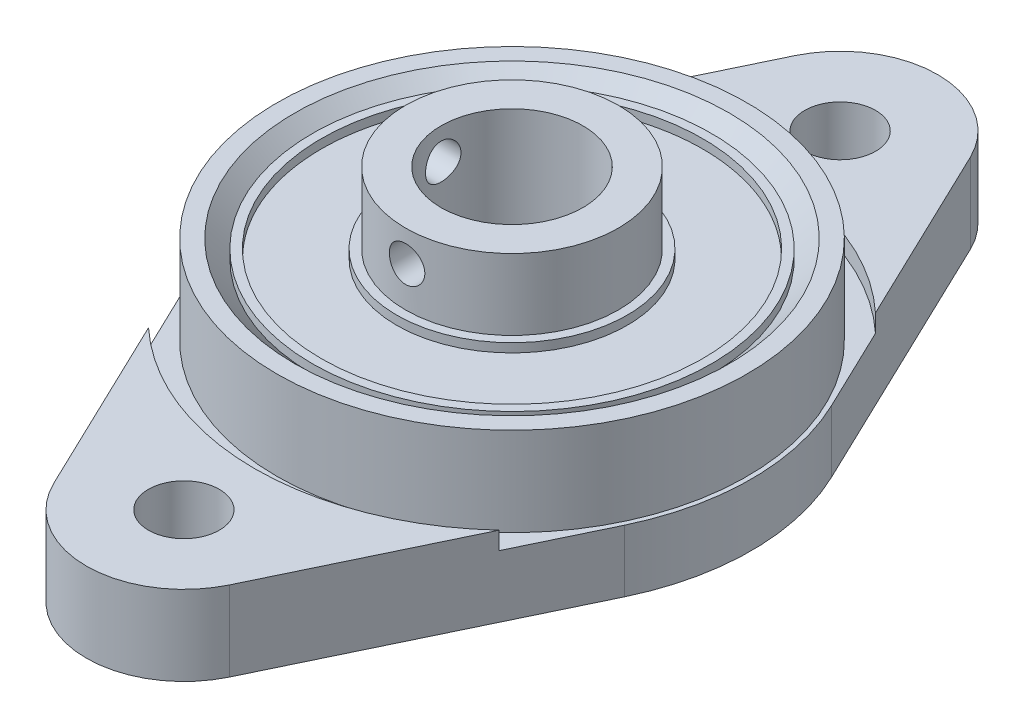
from build123d import *

# Parameters (mm, degrees)
SKETCH1_R             = 2
BOSS_EXTRUDE1_DEPTH   = 4.5
BOSS_EXTRUDE1_2_DEPTH = 4.5
SKETCH1_3_R           = 13.5
SKETCH1_3_R_2         = 13.25
BOSS_EXTRUDE2_DEPTH   = 3.5
SKETCH1_5_R           = 13.25
SKETCH1_5_R_2         = 12.25
BOSS_EXTRUDE3_DEPTH   = 8.5
SKETCH1_6_R           = 6
SKETCH1_6_R_2         = 4
BOSS_EXTRUDE4_DEPTH   = 12
SKETCH1_7_R           = 12.25
SKETCH1_7_R_2         = 11.25
BOSS_EXTRUDE5_DEPTH   = 8.5
CHAMFER1_SIZE         = 1
SKETCH2_R             = 11.25
SKETCH2_R_2           = 10.75
SKETCH2_R_3           = 6.5
SKETCH2_R_4           = 6
BOSS_EXTRUDE6_DEPTH   = 3.75
SKETCH2_3_R           = 10.75
SKETCH2_3_R_2         = 6.5
BOSS_EXTRUDE7_DEPTH   = 3.25
SKETCH3_R             = 1
CUT_EXTRUDE2_DEPTH    = 7.5
CIRPATTERN1_COUNT     = 2
CIRPATTERN1_ANGLE     = 90


with BuildPart() as part:
    # Sketch1 → Boss-Extrude1 (new body)
    with BuildSketch(Plane(origin=(0, 0, 0), x_dir=(1, 0, 0), z_dir=(0, 1, 0))):
        with BuildLine():
            Line((4.959164878, -20.878378378), (9.88427826, -10.609007648))
            ThreePointArc((9.88427826, -10.609007648), (0, -14.5), (-9.88427826, -10.609007648))
            Line((-9.88427826, -10.609007648), (-4.959164878, -20.878378378))
            ThreePointArc((-4.959164878, -20.878378378), (0, -24), (4.959164878, -20.878378378))
        make_face()
        with Locations(Location((0, -18.5, 0), (0, 0, 270))):
            Circle(SKETCH1_R, mode=Mode.SUBTRACT)
    extrude(amount=BOSS_EXTRUDE1_DEPTH)



with BuildPart() as body_2:
    # Sketch1 → Boss-Extrude1 2 (new body)
    with BuildSketch(Plane(origin=(0, 0, 0), x_dir=(1, 0, 0), z_dir=(0, 1, 0))):
        with BuildLine():
            ThreePointArc((-9.88427826, 10.609007648), (0, 14.5), (9.88427826, 10.609007648))
            Line((9.88427826, 10.609007648), (4.959164878, 20.878378378))
            ThreePointArc((4.959164878, 20.878378378), (0, 24), (-4.959164878, 20.878378378))
            Line((-4.959164878, 20.878378378), (-9.88427826, 10.609007648))
        make_face()
        with Locations(Location((0, 18.5, 0), (0, 0, 270))):
            Circle(SKETCH1_R, mode=Mode.SUBTRACT)
    extrude(amount=BOSS_EXTRUDE1_2_DEPTH)


with BuildPart() as part_1:
    add(part.part)

    add(body_2.part)  # Boss-Extrude2 merges body 2
    # Sketch1<3> → Boss-Extrude2 (add)
    # profile 1 of 3: a face of its own
    with BuildSketch(Plane(origin=(0, 0, 0), x_dir=(1, 0, 0), z_dir=(0, 1, 0))):
        with BuildLine():
            Line((9.88427826, -10.609007648), (12.17249561, -5.837837838))
            ThreePointArc((12.17249561, -5.837837838), (0, -13.5), (-12.17249561, -5.837837838))
            Line((-12.17249561, -5.837837838), (-9.88427826, -10.609007648))
            ThreePointArc((-9.88427826, -10.609007648), (0, -14.5), (9.88427826, -10.609007648))
        make_face()
    # profile 2 of 3: a face of its own
    with BuildSketch(Plane(origin=(0, 0, 0), x_dir=(1, 0, 0), z_dir=(0, 1, 0))):
        with BuildLine():
            ThreePointArc((-12.17249561, 5.837837838), (0, 13.5), (12.17249561, 5.837837838))
            Line((12.17249561, 5.837837838), (9.88427826, 10.609007648))
            ThreePointArc((9.88427826, 10.609007648), (0, 14.5), (-9.88427826, 10.609007648))
            Line((-9.88427826, 10.609007648), (-12.17249561, 5.837837838))
        make_face()
    # profile 3 of 3: a face of its own
    with BuildSketch(Plane(origin=(0, 0, 0), x_dir=(1, 0, 0), z_dir=(0, 1, 0))):
        Circle(SKETCH1_3_R)
        with Locations(Location((0, 0, 0), (0, 0, 270))):
            Circle(SKETCH1_3_R_2, mode=Mode.SUBTRACT)
    extrude(amount=BOSS_EXTRUDE2_DEPTH)

    # Sketch1<5> → Boss-Extrude3 (add)
    with BuildSketch(Plane(origin=(0, 0, 0), x_dir=(1, 0, 0), z_dir=(0, 1, 0))):
        with Locations(Location((0, 0, 0), (0, 0, 270))):
            Circle(SKETCH1_5_R)
        with Locations(Location((0, 0, 0), (0, 0, 270))):
            Circle(SKETCH1_5_R_2, mode=Mode.SUBTRACT)
    extrude(amount=BOSS_EXTRUDE3_DEPTH)



with BuildPart() as body_2_2:
    # Sketch1<6> → Boss-Extrude4 (new body)
    with BuildSketch(Plane(origin=(0, 0, 0), x_dir=(1, 0, 0), z_dir=(0, 1, 0))):
        with Locations(Location((0, 0, 0), (0, 0, 270))):
            Circle(SKETCH1_6_R)
        with Locations(Location((0, 0, 0), (0, 0, 270))):
            Circle(SKETCH1_6_R_2, mode=Mode.SUBTRACT)
    extrude(amount=BOSS_EXTRUDE4_DEPTH)


with BuildPart() as body_3:
    # Sketch1<7> → Boss-Extrude5 (new body)
    with BuildSketch(Plane(origin=(0, 0, 0), x_dir=(1, 0, 0), z_dir=(0, 1, 0))):
        with Locations(Location((0, 0, 0), (0, 0, 270))):
            Circle(SKETCH1_7_R)
        with Locations(Location((0, 0, 0), (0, 0, 270))):
            Circle(SKETCH1_7_R_2, mode=Mode.SUBTRACT)
    extrude(amount=BOSS_EXTRUDE5_DEPTH)

    # Chamfer1
    chamfer1_edges = [body_3.edges().sort_by_distance(p)[0] for p in [
        (0, 8.5, -11.25),
    ]]
    chamfer(chamfer1_edges, length=CHAMFER1_SIZE - 0.0001)  # a hair under: the kernel refuses the full size


with BuildPart() as part_2:
    add(part_1.part)

    add(body_3.part)  # Boss-Extrude6 merges body 3

    add(body_2_2.part)  # Boss-Extrude6 merges body 2 2
    # Sketch2 → Boss-Extrude6 (add, symmetric)
    # profile 1 of 2: a face of its own
    with BuildSketch(Plane(origin=(0, 4.25, 0), x_dir=(-1, 0, 0), z_dir=(0, -1, 0))):
        with Locations(Location((0, 0, 0), (0, 0, 90))):
            Circle(SKETCH2_R)
        with Locations(Location((0, 0, 0), (0, 0, 270))):
            Circle(SKETCH2_R_2, mode=Mode.SUBTRACT)
    # profile 2 of 2: a face of its own
    with BuildSketch(Plane(origin=(0, 4.25, 0), x_dir=(-1, 0, 0), z_dir=(0, -1, 0))):
        with Locations(Location((0, 0, 0), (0, 0, 270))):
            Circle(SKETCH2_R_3)
        with Locations(Location((0, 0, 0), (0, 0, 90))):
            Circle(SKETCH2_R_4, mode=Mode.SUBTRACT)
    extrude(amount=BOSS_EXTRUDE6_DEPTH, both=True)

    # Sketch3 → Cut-Extrude2 (cut)
    with BuildSketch(Plane(origin=(0, 0, 0), x_dir=(0, 0, -1), z_dir=(1, 0, 0))):
        with Locations((-0.002027508, 10.25)):
            Circle(SKETCH3_R)
    cut_extrude2 = extrude(amount=-CUT_EXTRUDE2_DEPTH, mode=Mode.SUBTRACT)

    # CirPattern1: Cut-Extrude2 ×2 about axis
    cirpattern1_axis = Axis((0, 12, 0), (0, 1, 0))
    for i in range(1, CIRPATTERN1_COUNT):
        add(cut_extrude2.rotate(cirpattern1_axis, i * CIRPATTERN1_ANGLE / (CIRPATTERN1_COUNT - 1)), mode=Mode.SUBTRACT)


with BuildPart() as body_2_3:
    # Sketch2<3> → Boss-Extrude7 (new, symmetric)
    with BuildSketch(Plane(origin=(0, 4.25, 0), x_dir=(-1, 0, 0), z_dir=(0, -1, 0))):
        with Locations(Location((0, 0, 0), (0, 0, 90))):
            Circle(SKETCH2_3_R)
        with Locations(Location((0, 0, 0), (0, 0, 90))):
            Circle(SKETCH2_3_R_2, mode=Mode.SUBTRACT)
    extrude(amount=BOSS_EXTRUDE7_DEPTH, both=True)


solid = Compound([part_2.part, body_2_3.part])
